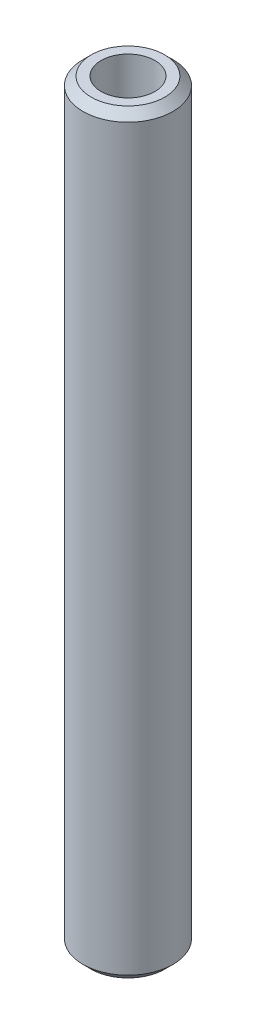
from build123d import *

# Parameters (mm, degrees)
SKETCH1_R           = 30
BOSS_EXTRUDE1_DEPTH = 503.589973222
SKETCH2_R           = 17.945606865
CUT_EXTRUDE1_DEPTH  = 506.373981453
CHAMFER1_SIZE       = 5.499762733


with BuildPart() as part:
    # Sketch1 → Boss-Extrude1 (new body)
    with BuildSketch(Plane(origin=(0, 0, 0), x_dir=(1, 0, 0), z_dir=(0, 1, 0))):
        Circle(SKETCH1_R)
    extrude(amount=BOSS_EXTRUDE1_DEPTH)

    # Sketch2 → Cut-Extrude1 (cut, through all)
    with BuildSketch(Plane(origin=(0, 0, 0), x_dir=(1, 0, 0), z_dir=(0, 1, 0))):
        Circle(SKETCH2_R)
    extrude(amount=CUT_EXTRUDE1_DEPTH, mode=Mode.SUBTRACT)

    # Chamfer1
    chamfer1_edges = [part.edges().sort_by_distance(p)[0] for p in [
        (-30, 503.589973222, 0),
        (-30, 0, 0),
    ]]
    chamfer(chamfer1_edges, length=CHAMFER1_SIZE)


solid = part.part
